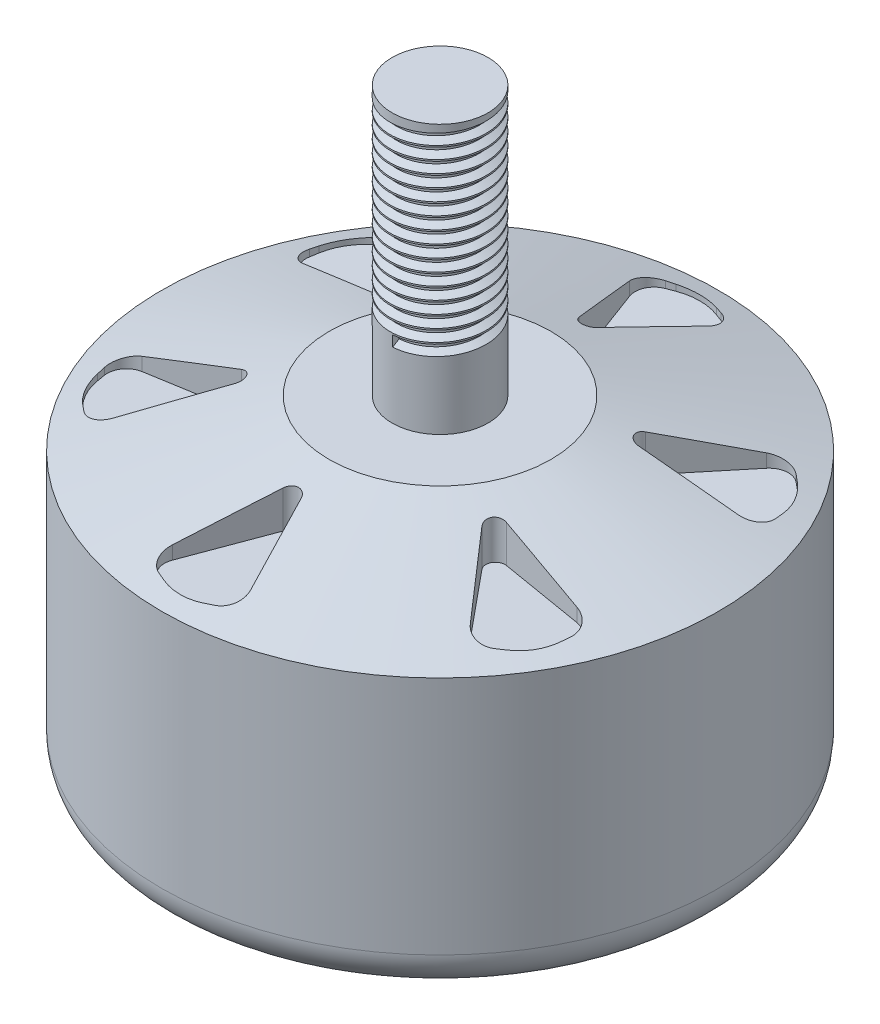
from build123d import *

# Parameters (mm, degrees)
SKETCH1_R           = 14.5
BOSS_EXTRUDE1_DEPTH = 17
SKETCH2_R           = 2.5
BOSS_EXTRUDE2_DEPTH = 14
CHAMFER1_SIZE       = 2.5
CHAMFER1_SIZE2      = 8.71853611
FILLET1_R           = 2
CUT_EXTRUDE1_DEPTH  = 2.5
THREAD1_PITCH       = 0.635
SKETCH14_R          = 1.5
CUT_EXTRUDE2_DEPTH  = 4
SKETCH15_R          = 3
BOSS_EXTRUDE3_DEPTH = 1


with BuildPart() as part:
    # Sketch1 → Boss-Extrude1 (new body)
    with BuildSketch(Plane(origin=(0, 0, 0), x_dir=(1, 0, 0), z_dir=(0, 1, 0))):
        with Locations(Location((0, 0, 0), (0, 0, 270))):
            Circle(SKETCH1_R)
    extrude(amount=BOSS_EXTRUDE1_DEPTH)

    # Sketch2 → Boss-Extrude2 (add)
    with BuildSketch(Plane(origin=(0, 17, 0), x_dir=(1, 0, 0), z_dir=(0, 1, 0))):
        with Locations(Location((0, 0, 0), (0, 0, 270))):
            Circle(SKETCH2_R)
    extrude(amount=BOSS_EXTRUDE2_DEPTH)

    # Chamfer1
    chamfer1_edges = [part.edges().sort_by_distance(p)[0] for p in [
        (0, 17, -14.5),
    ]]
    chamfer1_side = [part.faces().sort_by_distance(p)[0] for p in [
        (0, 8.5, -14.5),
    ]]
    chamfer(chamfer1_edges, length=CHAMFER1_SIZE, length2=CHAMFER1_SIZE2, reference=chamfer1_side[0])

    # Fillet1
    fillet1_edges = [part.edges().sort_by_distance(p)[0] for p in [
        (0, 0, -14.5),
    ]]
    fillet(fillet1_edges, radius=FILLET1_R)

    # Sketch4 → Cut-Extrude1 (cut)
    with BuildSketch(Plane(origin=(0, 17, 0), x_dir=(1, 0, 0), z_dir=(0, 1, 0))):
        with BuildLine():
            Line((0.468396098, 7.704863631), (2.037861776, 11.906981414))
            ThreePointArc((2.037861776, 11.906981414), (2.010888628, 12.671872836), (1.450955822, 13.193659851))
            Line((1.450955822, 13.193659851), (1.049658725, 13.343541899))
            ThreePointArc((1.049658725, 13.343541899), (0, 13.533165313), (-1.049658725, 13.343541899))
            Line((-1.049658725, 13.343541899), (-1.450955822, 13.193659851))
            ThreePointArc((-1.450955822, 13.193659851), (-2.010888628, 12.671872836), (-2.037861776, 11.906981414))
            Line((-2.037861776, 11.906981414), (-0.468396098, 7.704863631))
            ThreePointArc((-0.468396098, 7.704863631), (0, 7.379806752), (0.468396098, 7.704863631))
        make_face()
        with BuildLine():
            Line((-10.700566689, 7.853394527), (-11.031016899, 7.580802071))
            ThreePointArc((-11.031016899, 7.580802071), (-11.720064954, 6.766582656), (-12.080675624, 5.762739828))
            Line((-12.080675624, 5.762739828), (-12.151522511, 5.340265324))
            ThreePointArc((-12.151522511, 5.340265324), (-11.979608103, 4.594455782), (-11.330679275, 4.18865064))
            Line((-11.330679275, 4.18865064), (-6.906805686, 3.446788896))
            ThreePointArc((-6.906805686, 3.446788896), (-6.391100123, 3.689903376), (-6.438409589, 4.258074735))
            Line((-6.438409589, 4.258074735), (-9.292817499, 7.718330774))
            ThreePointArc((-9.292817499, 7.718330774), (-9.968719475, 8.077417054), (-10.700566689, 7.853394527))
        make_face()
        with BuildLine():
            Line((-12.151522511, -5.340265324), (-12.080675624, -5.762739828))
            ThreePointArc((-12.080675624, -5.762739828), (-11.720064954, -6.766582656), (-11.031016899, -7.580802071))
            Line((-11.031016899, -7.580802071), (-10.700566689, -7.853394527))
            ThreePointArc((-10.700566689, -7.853394527), (-9.968719475, -8.077417054), (-9.292817499, -7.718330774))
            Line((-9.292817499, -7.718330774), (-6.438409589, -4.258074735))
            ThreePointArc((-6.438409589, -4.258074735), (-6.391100123, -3.689903376), (-6.906805686, -3.446788896))
            Line((-6.906805686, -3.446788896), (-11.330679275, -4.18865064))
            ThreePointArc((-11.330679275, -4.18865064), (-11.979608103, -4.594455782), (-12.151522511, -5.340265324))
        make_face()
        with BuildLine():
            Line((-1.450955822, -13.193659851), (-1.049658725, -13.343541899))
            ThreePointArc((-1.049658725, -13.343541899), (0, -13.533165313), (1.049658725, -13.343541899))
            Line((1.049658725, -13.343541899), (1.450955822, -13.193659851))
            ThreePointArc((1.450955822, -13.193659851), (2.010888628, -12.671872836), (2.037861776, -11.906981414))
            Line((2.037861776, -11.906981414), (0.468396098, -7.704863631))
            ThreePointArc((0.468396098, -7.704863631), (0, -7.379806752), (-0.468396098, -7.704863631))
            Line((-0.468396098, -7.704863631), (-2.037861776, -11.906981414))
            ThreePointArc((-2.037861776, -11.906981414), (-2.010888628, -12.671872836), (-1.450955822, -13.193659851))
        make_face()
        with BuildLine():
            Line((10.700566689, -7.853394527), (11.031016899, -7.580802071))
            ThreePointArc((11.031016899, -7.580802071), (11.720064954, -6.766582656), (12.080675624, -5.762739828))
            Line((12.080675624, -5.762739828), (12.151522511, -5.340265324))
            ThreePointArc((12.151522511, -5.340265324), (11.979608103, -4.594455782), (11.330679275, -4.18865064))
            Line((11.330679275, -4.18865064), (6.906805686, -3.446788896))
            ThreePointArc((6.906805686, -3.446788896), (6.391100123, -3.689903376), (6.438409589, -4.258074735))
            Line((6.438409589, -4.258074735), (9.292817499, -7.718330774))
            ThreePointArc((9.292817499, -7.718330774), (9.968719475, -8.077417054), (10.700566689, -7.853394527))
        make_face()
        with BuildLine():
            Line((12.151522511, 5.340265324), (12.080675624, 5.762739828))
            ThreePointArc((12.080675624, 5.762739828), (11.720064954, 6.766582656), (11.031016899, 7.580802071))
            Line((11.031016899, 7.580802071), (10.700566689, 7.853394527))
            ThreePointArc((10.700566689, 7.853394527), (9.968719475, 8.077417054), (9.292817499, 7.718330774))
            Line((9.292817499, 7.718330774), (6.438409589, 4.258074735))
            ThreePointArc((6.438409589, 4.258074735), (6.391100123, 3.689903376), (6.906805686, 3.446788896))
            Line((6.906805686, 3.446788896), (11.330679275, 4.18865064))
            ThreePointArc((11.330679275, 4.18865064), (11.979608103, 4.594455782), (12.151522511, 5.340265324))
        make_face()
    extrude(amount=-CUT_EXTRUDE1_DEPTH, mode=Mode.SUBTRACT)

    # Thread1: the profile of Thread Profile1 profile screwed along a right-hand helix of 15.748031 turns, 6 arcs to a turn; built about Z, then put on its axis
    thread1_z = Axis((0, 0, 0), (0, 0, 1))
    thread1_corners = [(2.5003, 0, -0.000173205), (2.5003, 0, 0.555798203), (2.156296169, 0, 0.357187499), (2.156296169, 0, 0.198437499)]
    with BuildLine(mode=Mode.PRIVATE) as thread1_profile:
        Line(thread1_corners[0], thread1_corners[1])
        Line(thread1_corners[1], thread1_corners[2])
        Line(thread1_corners[2], thread1_corners[3])
        Line(thread1_corners[3], thread1_corners[0])
    thread1_cap = Face(thread1_profile.wire())
    thread1_turn_angles = [0, 30, 60, 90, 120, 150, 180, 210, 240, 270, 300, 330, 360]
    thread1_turn_weights = [1, 0.8660254037844387, 1, 0.8660254037844387, 1, 0.8660254037844387, 1, 0.8660254037844387, 1, 0.8660254037844387, 1, 0.8660254037844387, 1]
    thread1_turn_rails = [Edge.make_bspline([Vector(p[0], p[1], 0).rotate(thread1_z, thread1_turn_angles[k]) / thread1_turn_weights[k] + Vector(0, 0, p[2] + THREAD1_PITCH * thread1_turn_angles[k] / 360) for k in range(13)], [0, 0, 0, 1, 1, 2, 2, 3, 3, 4, 4, 5, 5, 6, 6, 6], 2, thread1_turn_weights) for p in thread1_corners]
    thread1_turn_sides = [Face.make_surface_from_curves(thread1_turn_rails[p[0]], thread1_turn_rails[p[1]]) for p in [(0, 1), (1, 2), (2, 3), (3, 0)]]
    thread1_last_angles = [5400, 5430, 5460, 5490, 5520, 5550, 5580, 5610, 5640, 5654.645669291, 5669.291338583]
    thread1_last_weights = [1, 0.8660254037844387, 1, 0.8660254037844387, 1, 0.8660254037844387, 1, 0.8660254037844387, 1, 0.9675079437748935, 1]
    thread1_last_rails = [Edge.make_bspline([Vector(p[0], p[1], 0).rotate(thread1_z, thread1_last_angles[k]) / thread1_last_weights[k] + Vector(0, 0, p[2] + THREAD1_PITCH * thread1_last_angles[k] / 360) for k in range(11)], [0, 0, 0, 1, 1, 2, 2, 3, 3, 4, 4, 5, 5, 5], 2, thread1_last_weights) for p in thread1_corners]
    thread1_last_sides = [Face.make_surface_from_curves(thread1_last_rails[p[0]], thread1_last_rails[p[1]]) for p in [(0, 1), (1, 2), (2, 3), (3, 0)]]
    thread1 = Plane(origin=(0, 31, 0), x_dir=(-1, 0, 0), z_dir=(0, -1, 0)) * Solid(Shell([*[p.moved(Location((0, 0, THREAD1_PITCH * i))) for i in range(15) for p in thread1_turn_sides], *thread1_last_sides, thread1_cap, thread1_cap.rotate(thread1_z, 5669.291338583).moved(Location((0, 0, THREAD1_PITCH * 5669.291338583 / 360)))]))
    add(thread1, mode=Mode.SUBTRACT)

    # Sketch14 → Cut-Extrude2 (cut)
    with BuildSketch(Plane.XZ):
        with Locations(Location((-2.11693705, 7.714828418, 0), (0, 0, 270))):
            Circle(SKETCH14_R)
        with Locations(Location((2.11693705, -7.714828418, 0), (0, 0, 270))):
            Circle(SKETCH14_R)
        with Locations(Location((-9.161358747, -2.513862747, 0), (0, 0, 270))):
            Circle(SKETCH14_R)
        with Locations(Location((9.161358747, 2.513862747, 0), (0, 0, 270))):
            Circle(SKETCH14_R)
    extrude(amount=-CUT_EXTRUDE2_DEPTH, mode=Mode.SUBTRACT)

    # Sketch15 → Boss-Extrude3 (add)
    with BuildSketch(Plane.XZ):
        with Locations(Location((0, 0, 0), (0, 0, 90))):
            Circle(SKETCH15_R)
    extrude(amount=BOSS_EXTRUDE3_DEPTH)


solid = part.part
